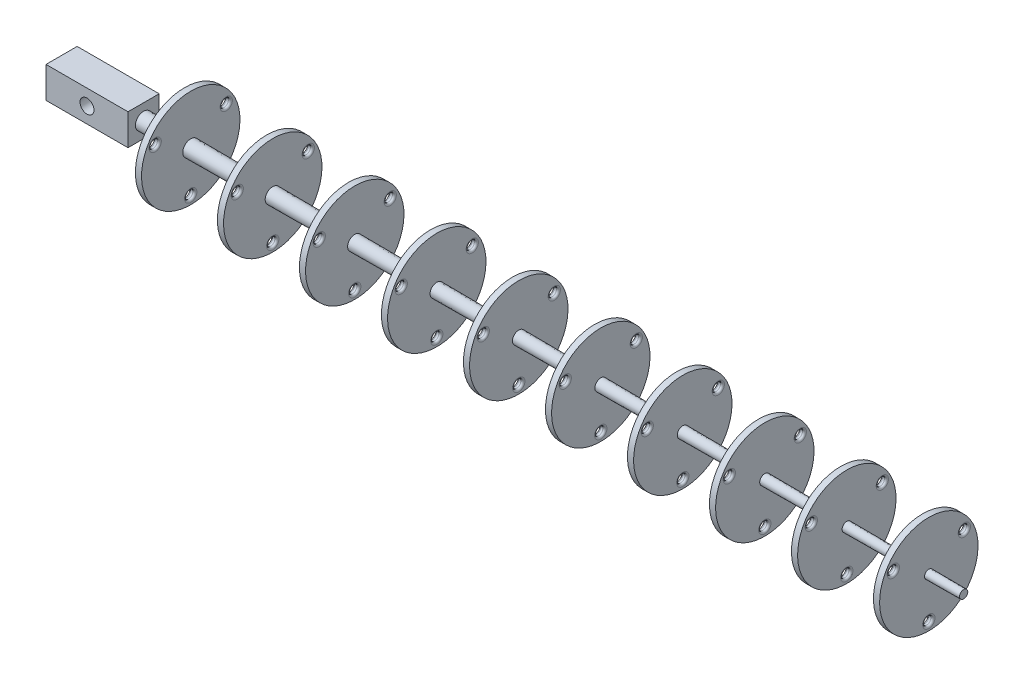
from build123d import *

# Parameters (mm, degrees)
SKETCH3_W                      = 1.5
SKETCH3_H                      = 12
CUT_EXTRUDE1_REACH             = 191.262
SKETCH5_R                      = 1
FILLET1_R                      = 0.5
LPATTERN1_COUNT                = 10
LPATTERN1_PITCH                = 20
FILLET1_OF_LPATTERN1_R         = 0.5
SKETCH16_W                     = 7.6
SKETCH16_H                     = 7.6
BOSS_EXTRUDE1_DEPTH            = 20
M3_CLEARANCE_HOLE1_D           = 3.4
M3_CLEARANCE_HOLE1_CSINK_D     = 3.45
M3_CLEARANCE_HOLE1_CSINK_ANGLE = 90


with BuildPart() as part:
    # Sketch2 → Revolve1 (revolve)
    with BuildSketch(Plane.XY):
        Polygon((0, 2), (200, 1), (200, 0), (0, 0), align=None)
    revolve(axis=Axis((200, 0, 0), (-1, 0, 0)))

    # Sketch3 → Revolve2 (revolve)
    with BuildSketch(Plane.XY):
        with Locations((10.75, 6)):
            Rectangle(SKETCH3_W, SKETCH3_H)
    revolve2 = revolve(axis=Axis((11.5, 0, 0), (-1, 0, 0)))

    # Sketch5 → Cut-Extrude1 (cut, up to next)
    with BuildSketch(Plane(origin=(11.5, 0, 0), x_dir=(0, 0, -1), z_dir=(1, 0, 0)), mode=Mode.PRIVATE) as cut_extrude1_sk1:
        with Locations((0, -10)):
            Circle(SKETCH5_R)
    cut_extrude1_tool1 = extrude(cut_extrude1_sk1.sketch, amount=-CUT_EXTRUDE1_REACH, mode=Mode.PRIVATE) & part.part
    # Sketch5 → Cut-Extrude1 (cut, up to next)
    with BuildSketch(Plane(origin=(11.5, 0, 0), x_dir=(0, 0, -1), z_dir=(1, 0, 0)), mode=Mode.PRIVATE) as cut_extrude1_sk2:
        with Locations((8.660254038, 5)):
            Circle(SKETCH5_R)
    cut_extrude1_tool2 = extrude(cut_extrude1_sk2.sketch, amount=-CUT_EXTRUDE1_REACH, mode=Mode.PRIVATE) & part.part
    # Sketch5 → Cut-Extrude1 (cut, up to next)
    with BuildSketch(Plane(origin=(11.5, 0, 0), x_dir=(0, 0, -1), z_dir=(1, 0, 0)), mode=Mode.PRIVATE) as cut_extrude1_sk3:
        with Locations((-8.660254038, 5)):
            Circle(SKETCH5_R)
    cut_extrude1_tool3 = extrude(cut_extrude1_sk3.sketch, amount=-CUT_EXTRUDE1_REACH, mode=Mode.PRIVATE) & part.part
    cut_extrude1_1 = cut_extrude1_tool1.solids().sort_by_distance((11.5, -10, 0))[0]
    add(cut_extrude1_1, mode=Mode.SUBTRACT)
    cut_extrude1_2 = cut_extrude1_tool2.solids().sort_by_distance((11.5, 5, -8.660254))[0]
    add(cut_extrude1_2, mode=Mode.SUBTRACT)
    cut_extrude1_3 = cut_extrude1_tool3.solids().sort_by_distance((11.5, 5, 8.660254))[0]
    add(cut_extrude1_3, mode=Mode.SUBTRACT)
    cut_extrude1 = cut_extrude1_1 + cut_extrude1_2 + cut_extrude1_3  # Cut-Extrude1 as one shape, for the pattern or mirror that repeats it

    # Fillet1
    fillet1_edges = [part.edges().sort_by_distance(p)[0] for p in [
        (10, 5, -7.660254038),
        (10, -10, 1),
        (11.5, -10, 1),
        (11.5, 5, -7.660254038),
        (10, 5, 9.660254038),
        (11.5, 5, 9.660254038),
    ]]
    fillet(fillet1_edges, radius=FILLET1_R)

    # LPattern1: Revolve2, Cut-Extrude1 ×10
    with Locations(*[(i * LPATTERN1_PITCH, 0, 0) for i in range(1, LPATTERN1_COUNT)]):
        add(revolve2)
        add(cut_extrude1, mode=Mode.SUBTRACT)

    # Fillet1 of LPattern1
    fillet1_of_lpattern1_edges = [part.edges().sort_by_distance(p)[0] for p in [
        (30, 5, -7.660254038),
        (30, -10, 1),
        (31.5, -10, 1),
        (31.5, 5, -7.660254038),
        (30, 5, 9.660254038),
        (31.5, 5, 9.660254038),
        (50, 5, -7.660254038),
        (50, -10, 1),
        (51.5, -10, 1),
        (51.5, 5, -7.660254038),
        (50, 5, 9.660254038),
        (51.5, 5, 9.660254038),
        (70, 5, -7.660254038),
        (70, -10, 1),
        (71.5, -10, 1),
        (71.5, 5, -7.660254038),
        (70, 5, 9.660254038),
        (71.5, 5, 9.660254038),
        (90, 5, -7.660254038),
        (90, -10, 1),
        (91.5, -10, 1),
        (91.5, 5, -7.660254038),
        (90, 5, 9.660254038),
        (91.5, 5, 9.660254038),
        (110, 5, -7.660254038),
        (110, -10, 1),
        (111.5, -10, 1),
        (111.5, 5, -7.660254038),
        (110, 5, 9.660254038),
        (111.5, 5, 9.660254038),
        (130, 5, -7.660254038),
        (130, -10, 1),
        (131.5, -10, 1),
        (131.5, 5, -7.660254038),
        (130, 5, 9.660254038),
        (131.5, 5, 9.660254038),
        (150, 5, -7.660254038),
        (150, -10, 1),
        (151.5, -10, 1),
        (151.5, 5, -7.660254038),
        (150, 5, 9.660254038),
        (151.5, 5, 9.660254038),
        (170, 5, -7.660254038),
        (170, -10, 1),
        (171.5, -10, 1),
        (171.5, 5, -7.660254038),
        (170, 5, 9.660254038),
        (171.5, 5, 9.660254038),
        (190, 5, -7.660254038),
        (190, -10, 1),
        (191.5, -10, 1),
        (191.5, 5, -7.660254038),
        (190, 5, 9.660254038),
        (191.5, 5, 9.660254038),
    ]]
    fillet(fillet1_of_lpattern1_edges, radius=FILLET1_OF_LPATTERN1_R)

    # Sketch16 → Boss-Extrude1 (add)
    with BuildSketch(Plane.ZY):
        Rectangle(SKETCH16_W, SKETCH16_H)
    extrude(amount=BOSS_EXTRUDE1_DEPTH)

    # M3 Clearance Hole1 (through all)
    with Locations(Plane(origin=(0, 0, -3.8), x_dir=(-1, 0, 0), z_dir=(0, 0, -1))):
        with Locations((10, 0)):
            CounterSinkHole(M3_CLEARANCE_HOLE1_D / 2, M3_CLEARANCE_HOLE1_CSINK_D / 2, counter_sink_angle=M3_CLEARANCE_HOLE1_CSINK_ANGLE)


solid = part.part
